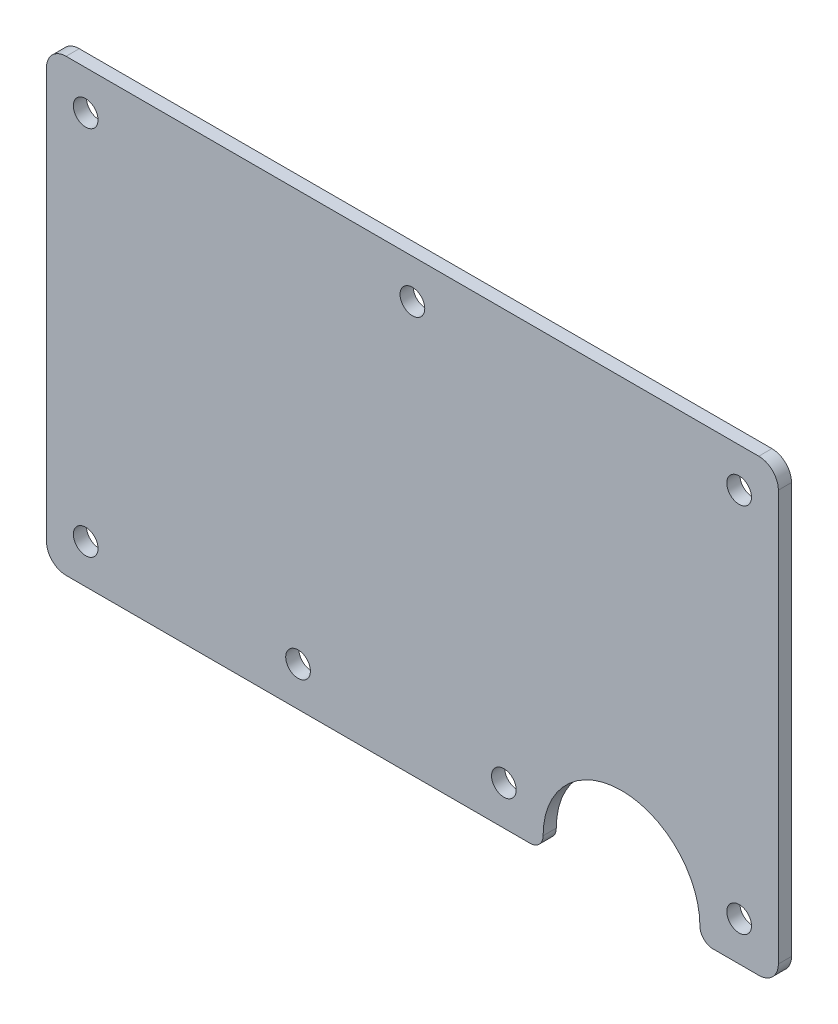
from build123d import *

# Parameters (mm, degrees)
SKETCH1_R           = 1.5
BOSS_EXTRUDE1_DEPTH = 1.6


with BuildPart() as part:
    # Sketch1 → Boss-Extrude1 (new body)
    with BuildSketch(Plane.XY.offset(1.6)):
        with BuildLine():
            Line((0, 53.320743496), (0, 3.473243496))
            ThreePointArc((0, 3.473243496), (0.697451977, 1.789445473), (2.38125, 1.091993496))
            Line((2.38125, 1.091993496), (58.7375, 1.091993496))
            ThreePointArc((58.7375, 1.091993496), (59.860032015, 1.556961481), (60.325, 2.679493496))
            ThreePointArc((60.325, 2.679493496), (69.85, 12.204493496), (79.375, 2.679493496))
            ThreePointArc((79.375, 2.679493496), (79.839967985, 1.556961481), (80.9625, 1.091993496))
            Line((80.9625, 1.091993496), (86.51875, 1.091993496))
            ThreePointArc((86.51875, 1.091993496), (88.202548023, 1.789445473), (88.9, 3.473243496))
            Line((88.9, 3.473243496), (88.9, 53.320743496))
            ThreePointArc((88.9, 53.320743496), (88.202548023, 55.004541519), (86.51875, 55.701993496))
            Line((86.51875, 55.701993496), (2.38125, 55.701993496))
            ThreePointArc((2.38125, 55.701993496), (0.697451977, 55.004541519), (0, 53.320743496))
        make_face()
        with Locations((4.7625, 50.939493496)):
            Circle(SKETCH1_R, mode=Mode.SUBTRACT)
        with Locations((4.7625, 5.854493496)):
            Circle(SKETCH1_R, mode=Mode.SUBTRACT)
        with Locations((84.1375, 5.854493496)):
            Circle(SKETCH1_R, mode=Mode.SUBTRACT)
        with Locations((84.1375, 50.939493496)):
            Circle(SKETCH1_R, mode=Mode.SUBTRACT)
        with Locations((30.559375, 5.854493496)):
            Circle(SKETCH1_R, mode=Mode.SUBTRACT)
        with Locations((55.5625, 5.854493496)):
            Circle(SKETCH1_R, mode=Mode.SUBTRACT)
        with Locations((44.45, 50.939493496)):
            Circle(SKETCH1_R, mode=Mode.SUBTRACT)
    extrude(amount=-BOSS_EXTRUDE1_DEPTH)


solid = part.part
